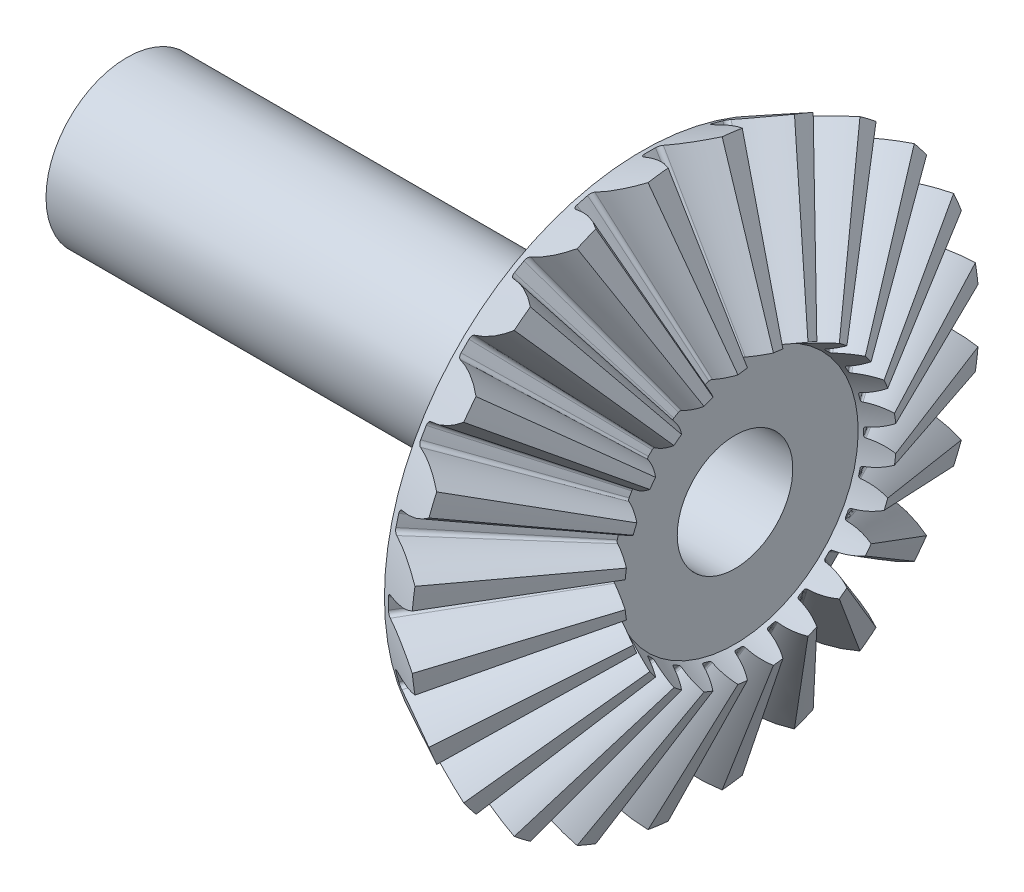
from build123d import *

# Parameters (mm, degrees)
TEETHCUTS_COUNT = 24
TEETHCUTS_ANGLE = 345
HUBSKE_R        = 3.5
HUB_DEPTH       = 22.285037461
BORSKE_R        = 2.5
BORE_DEPTH      = 30.0000508


with BuildPart() as part:
    # BasProSke → Base-Revolve (revolve)
    with BuildSketch(Plane(origin=(0, 0, 0), x_dir=(1, 0, 0), z_dir=(0, 1, 0)), mode=Mode.PRIVATE) as base_revolve_sk:
        Polygon((0, 0), (0, 11.142467933), (2.30091395, 12.292924904), (5.125742444, 5.87910123), (4.025328495, 5.328894258), (4.025328495, 0), align=None)
    revolve(base_revolve_sk.sketch.rotate(Axis((-10, 0, 0), (1, 0, 0)), 180), axis=Axis((-10, 0, 0), (1, 0, 0)))

    # ToothCut: read off the stored shape, not the designer's step
    # ToothCut: loft between two sections, ruled curve by curve
    toothcut_from = [
        Edge.make_bspline([(7.723651839, 0.004293849, -0.008312879), (7.718187749, 0.001561805, -0.015368804), (7.709864822, -0.002599659, -0.014649419), (7.705435657, -0.004814241, -0.00673838)], [0, 0, 0, 0, 1, 1, 1, 1], 3, [1, 0.729558285, 0.729558285, 1]),
        Edge.make_bspline([(7.705435657, -0.004814241, 0.00673838), (7.709864822, -0.002599659, 0.014649419), (7.718187749, 0.001561805, 0.015368804), (7.723651839, 0.004293849, 0.008312879)], [0, 0, 0, 0, 1, 1, 1, 1], 3, [1, 0.729558285, 0.729558285, 1]),
        Edge.make_bspline([(7.705435657, -0.004814241, -0.00673838), (7.704861752, -0.005101194, -0.005713314), (7.704423725, -0.005320207, -0.004607585), (7.704130438, -0.005466851, -0.003443562)], [0, 0, 0, 0, 1, 1, 1, 1], 3, [1, 0.9932568, 0.9932568, 1]),
        Edge.make_bspline([(7.704130438, -0.005466851, 0.003443562), (7.704423725, -0.005320207, 0.004607585), (7.704861752, -0.005101194, 0.005713314), (7.705435657, -0.004814241, 0.00673838)], [0, 0, 0, 0, 1, 1, 1, 1], 3, [1, 0.9932568, 0.9932568, 1]),
        Edge.make_bspline([(7.704130438, -0.005466851, -0.003443562), (7.70355942, -0.00575236, -0.001177256), (7.70355942, -0.00575236, 0.001177256), (7.704130438, -0.005466851, 0.003443562)], [0, 0, 0, 0, 1, 1, 1, 1], 3, [1, 0.975025372, 0.975025372, 1]),
        Edge.make_line((7.723651839, 0.004293849, 0.008312879), (7.723651839, 0.004293849, -0.008312879)),
    ]
    toothcut_to = [
        Edge.make_bspline([(2.467042523, 12.375989191, -1.317007542), (1.881121431, 12.083028645, -0.838483932), (1.207297185, 11.746116524, -0.537543138), (0.487747509, 11.386341686, -0.433022409)], [0, 0, 0, 0, 1, 1, 1, 1], 3, [1, 0.979135152, 0.979135152, 1]),
        Edge.make_bspline([(0.487747509, 11.386341686, 0.433022409), (1.207297185, 11.746116524, 0.537543138), (1.881121431, 12.083028645, 0.838483932), (2.467042523, 12.375989191, 1.317007542)], [0, 0, 0, 0, 1, 1, 1, 1], 3, [1, 0.979135152, 0.979135152, 1]),
        Edge.make_bspline([(0.487747509, 11.386341686, -0.433022409), (0.397621574, 11.341278719, -0.419930849), (0.338430856, 11.31168336, -0.342824961), (0.340525718, 11.312730791, -0.241241209)], [0, 0, 0, 0, 1, 1, 1, 1], 3, [1, 0.829081524, 0.829081524, 1]),
        Edge.make_bspline([(0.340525718, 11.312730791, 0.241241209), (0.338430856, 11.31168336, 0.342824961), (0.397621574, 11.341278719, 0.419930849), (0.487747509, 11.386341686, 0.433022409)], [0, 0, 0, 0, 1, 1, 1, 1], 3, [1, 0.829081524, 0.829081524, 1]),
        Edge.make_bspline([(0.340525718, 11.312730791, -0.241241209), (0.343842011, 11.314388938, -0.080427982), (0.343842011, 11.314388938, 0.080427982), (0.340525718, 11.312730791, 0.241241209)], [0, 0, 0, 0, 1, 1, 1, 1], 3, [1, 0.999822876, 0.999822876, 1]),
        Edge.make_line((2.467042523, 12.375989191, 1.317007542), (2.467042523, 12.375989191, -1.317007542)),
    ]
    toothcut = Solid(Shell([*[Face.make_surface_from_curves(toothcut_from[k], toothcut_to[k]) for k in range(6)], Face(Wire(toothcut_from)), Face(Wire(toothcut_to))]))
    add(toothcut, mode=Mode.SUBTRACT)

    # TeethCuts: ToothCut ×24 about axis
    teethcuts_axis = Axis((-10, 0, 0), (1, 0, 0))
    for i in range(1, TEETHCUTS_COUNT):
        add(toothcut.rotate(teethcuts_axis, i * TEETHCUTS_ANGLE / (TEETHCUTS_COUNT - 1)), mode=Mode.SUBTRACT)

    # HubSke → Hub (add)
    with BuildSketch(Plane.ZY):
        with Locations(Location((0, 0, 0), (0, 0, 180))):
            Circle(HUBSKE_R)
    extrude(amount=HUB_DEPTH)

    # BorSke → Bore (cut, symmetric)
    with BuildSketch(Plane(origin=(0, 0, 0), x_dir=(0, 0, -1), z_dir=(1, 0, 0))):
        with Locations(Location((0, 0, 0), (0, 0, 180))):
            Circle(BORSKE_R)
    extrude(amount=BORE_DEPTH, both=True, mode=Mode.SUBTRACT)


solid = part.part
